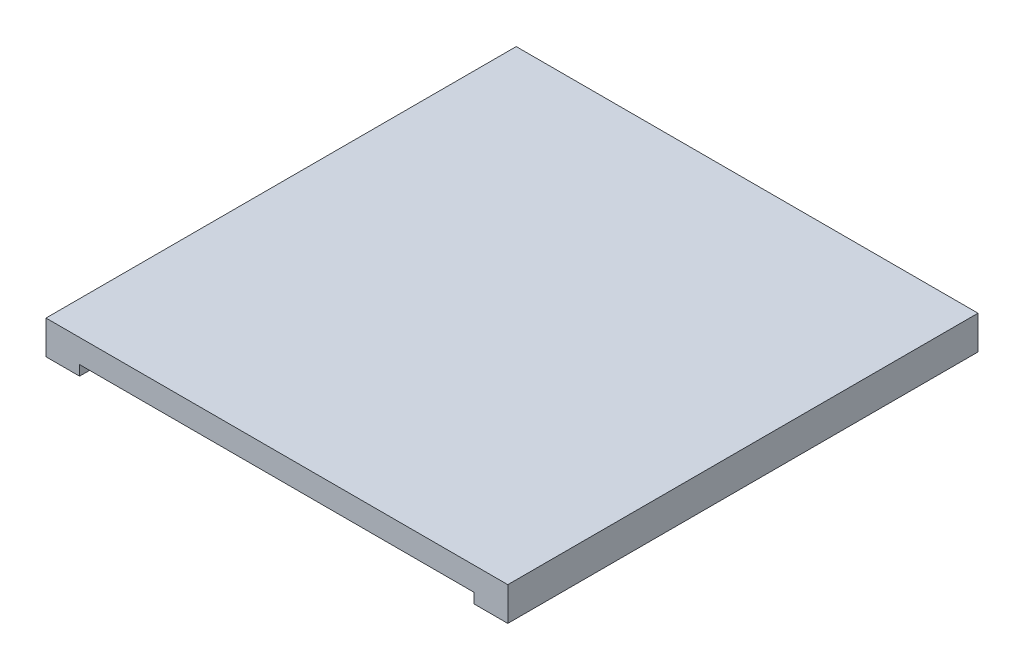
from build123d import *

# Parameters (mm, degrees)
SKETCH1_R                                      = 29.692527183
SKETCH1_R_2                                    = 22.692527183
SKETCH1_R_3                                    = 19.692527183
SKETCH1_R_4                                    = 16.692527183
BOSS_EXTRUDE1_DEPTH                            = 5
SKETCH9_W                                      = 27.5
SKETCH9_H                                      = 28
BOSS_EXTRUDE2_DEPTH                            = 7.5
SKETCH10_W                                     = 23.5
SKETCH10_H                                     = 25.45
CUT_EXTRUDE1_DEPTH                             = 6.1
SKETCH12_W                                     = 12
SKETCH12_H                                     = 11
CUT_EXTRUDE2_DEPTH                             = 3
SKETCH11_W                                     = 13
SKETCH11_H                                     = 9.717675131
CUT_EXTRUDE3_DEPTH                             = 4.947760199
CSK_FOR_M3_FLAT_HEAD_MACHINE_SCREW1_AT_2_COUNT = 2
CSK_FOR_M3_FLAT_HEAD_MACHINE_SCREW1_AT_2_PITCH = 27.84943902
CSK_FOR_M3_FLAT_HEAD_MACHINE_SCREW1_AT_3_COUNT = 2
CSK_FOR_M3_FLAT_HEAD_MACHINE_SCREW1_AT_3_PITCH = 27.84943902
CSK_FOR_M3_FLAT_HEAD_MACHINE_SCREW1_AT_4_COUNT = 2
CSK_FOR_M3_FLAT_HEAD_MACHINE_SCREW1_AT_4_PITCH = 39.385054366
SPLIT1_START                                   = -28
SPLIT1_DEPTH                                   = 28
SPLIT1_2_OUTLINE_W                             = 23.5
SPLIT1_2_OUTLINE_H                             = 0.6
SPLIT1_2_DEPTH                                 = 2.602239801
SPLIT1_START_2                                 = 5.5
SPLIT1_3_OUTLINE_W                             = 27.5
SPLIT1_3_OUTLINE_H                             = 28
SPLIT1_3_DEPTH                                 = 2


# Read off the part's stored shape, not the designer's step: Split1
with BuildPart() as part:
    # Sketch1 → Boss-Extrude1 (new body)
    # profile 1 of 4: a face of its own
    with BuildSketch(Plane(origin=(0, 0, 0), x_dir=(-1, 0, 0), z_dir=(0, 0, 1))):
        with Locations(Location((0, 0, 0), (0, 0, 180))):
            Circle(SKETCH1_R)
        Circle(SKETCH1_R_2, mode=Mode.SUBTRACT)
    # profile 2 of 4: a face of its own
    with BuildSketch(Plane(origin=(0, 0, 0), x_dir=(-1, 0, 0), z_dir=(0, 0, 1))):
        Circle(SKETCH1_R_2)
        Circle(SKETCH1_R_3, mode=Mode.SUBTRACT)
    # profile 3 of 4: a face of its own
    with BuildSketch(Plane(origin=(0, 0, 0), x_dir=(-1, 0, 0), z_dir=(0, 0, 1))):
        Circle(SKETCH1_R_3)
        Circle(SKETCH1_R_4, mode=Mode.SUBTRACT)
    # profile 4 of 4: a face of its own
    with BuildSketch(Plane(origin=(0, 0, 0), x_dir=(-1, 0, 0), z_dir=(0, 0, 1))):
        with BuildLine():
            Line((14.058465911, 9), (-14.058465911, 9))
            ThreePointArc((-14.058465911, 9), (-16.692527183, 0), (-14.058465911, -9))
            Line((-14.058465911, -9), (14.058465911, -9))
            ThreePointArc((14.058465911, -9), (16.020483578, -4.688770595), (16.692527183, 0))
            ThreePointArc((16.692527183, 0), (16.020483578, 4.688770595), (14.058465911, 9))
        make_face()
    extrude(amount=BOSS_EXTRUDE1_DEPTH)

    # Sketch9 → Boss-Extrude2 (add, symmetric)
    with BuildSketch(Plane(origin=(0, 0, 0), x_dir=(1, 0, 0), z_dir=(0, 1, 0))):
        with Locations((5.7, 14)):
            Rectangle(SKETCH9_W, SKETCH9_H)
    extrude(amount=BOSS_EXTRUDE2_DEPTH, both=True)

    # Sketch10 → Cut-Extrude1 (cut, symmetric)
    with BuildSketch(Plane(origin=(0, 0, 0), x_dir=(1, 0, 0), z_dir=(0, 1, 0))):
        with Locations((5.7, 12.672760199)):
            Rectangle(SKETCH10_W, SKETCH10_H)
    extrude(amount=CUT_EXTRUDE1_DEPTH, both=True, mode=Mode.SUBTRACT)

    # Sketch12 → Cut-Extrude2 (cut)
    with BuildSketch(Plane.XY.offset(-28)):
        with Locations((1.95, 0)):
            Rectangle(SKETCH12_W, SKETCH12_H)
    extrude(amount=CUT_EXTRUDE2_DEPTH, mode=Mode.SUBTRACT)

    # Sketch11 → Cut-Extrude3 (cut)
    with BuildSketch(Plane.XY.offset(5)):
        with Locations((-1.55, -0.433824782)):
            Rectangle(SKETCH11_W, SKETCH11_H)
    extrude(amount=-CUT_EXTRUDE3_DEPTH, mode=Mode.SUBTRACT)

    # Sketch13 → CSK for M3 Flat Head Machine Screw1 (revolve, cut)
    with BuildSketch(Plane.YZ.offset(-19.692527183)):
        Polygon((0, 0), (0, 13.021463052), (1.7, 12), (1.7, 1.95), (3.65, 0), align=None)
    csk_for_m3_flat_head_machine_screw1 = revolve(axis=Axis((-19.692527183, 0, -6.35), (0, 0, 1)), mode=Mode.SUBTRACT)

    # CSK for M3 Flat Head Machine Screw1 at 2: CSK for M3 Flat Head Machine Screw1 ×2
    with Locations(*[Vector(0.7071067811865476, -0.7071067811865475, 0) * (i * CSK_FOR_M3_FLAT_HEAD_MACHINE_SCREW1_AT_2_PITCH) for i in range(1, CSK_FOR_M3_FLAT_HEAD_MACHINE_SCREW1_AT_2_COUNT)]):
        add(csk_for_m3_flat_head_machine_screw1, mode=Mode.SUBTRACT)

    # CSK for M3 Flat Head Machine Screw1 at 3: CSK for M3 Flat Head Machine Screw1 ×2
    with Locations(*[Vector(0.7071067811865476, 0.7071067811865475, 0) * (i * CSK_FOR_M3_FLAT_HEAD_MACHINE_SCREW1_AT_3_PITCH) for i in range(1, CSK_FOR_M3_FLAT_HEAD_MACHINE_SCREW1_AT_3_COUNT)]):
        add(csk_for_m3_flat_head_machine_screw1, mode=Mode.SUBTRACT)

    # CSK for M3 Flat Head Machine Screw1 at 4: CSK for M3 Flat Head Machine Screw1 ×2
    with Locations(*[(i * CSK_FOR_M3_FLAT_HEAD_MACHINE_SCREW1_AT_4_PITCH, 0, 0) for i in range(1, CSK_FOR_M3_FLAT_HEAD_MACHINE_SCREW1_AT_4_COUNT)]):
        add(csk_for_m3_flat_head_machine_screw1, mode=Mode.SUBTRACT)

    # Split1 3 outline → Split1 3 (cut)
    with BuildSketch(Plane(origin=(0, 0, 0), x_dir=(1, 0, 0), z_dir=(0, 1, 0)).offset(SPLIT1_START_2)):
        with Locations((5.7, 14)):
            Rectangle(SPLIT1_3_OUTLINE_W, SPLIT1_3_OUTLINE_H)
    extrude(amount=SPLIT1_3_DEPTH, mode=Mode.SUBTRACT)


with BuildPart() as body_2:
    # Split1 outline → Split1 (new body)
    with BuildSketch(Plane.XY.offset(SPLIT1_START)):
        Polygon((-8.05, 5.5), (-6.05, 5.5), (-6.05, 6.1), (17.45, 6.1), (17.45, 5.5), (19.45, 5.5), (19.45, 7.5), (-8.05, 7.5), align=None)
    extrude(amount=SPLIT1_DEPTH)

    # Split1 2 outline → Split1 2 (add)
    with BuildSketch(Plane.XY.offset(SPLIT1_START)):
        with Locations((5.7, 5.8)):
            Rectangle(SPLIT1_2_OUTLINE_W, SPLIT1_2_OUTLINE_H)
    extrude(amount=SPLIT1_2_DEPTH)


solid = body_2.part
